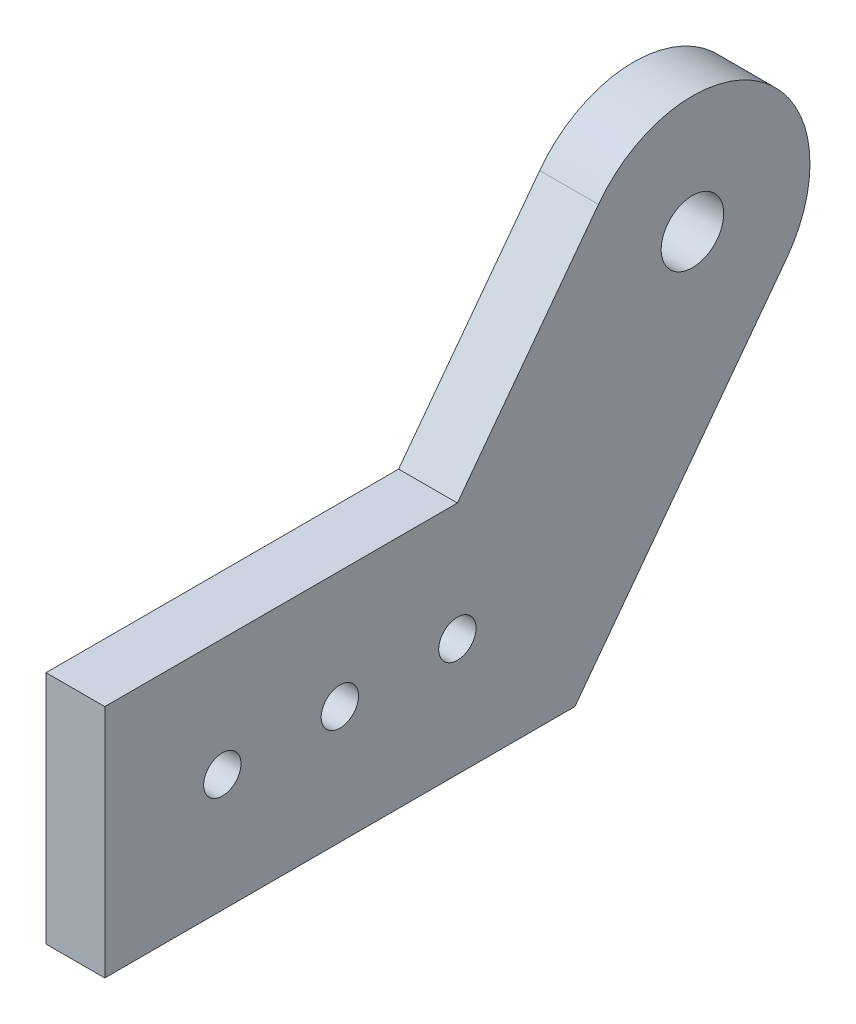
from build123d import *

# Parameters (mm, degrees)
BOSS_EXTRUDE1_DEPTH     = 6.35
F_10_32_TAPPED_HOLE1_D  = 4.0386
F_1_4_CLEARANCE_HOLE1_D = 6.7564


with BuildPart() as part:
    # Sketch1 → Boss-Extrude1 (new body)
    with BuildSketch(Plane(origin=(0, 0, 0), x_dir=(0, 0, -1), z_dir=(1, 0, 0))):
        with BuildLine():
            Line((50.8, 0), (73.66, 30.48))
            ThreePointArc((73.66, 30.48), (71.12, 48.26), (53.34, 45.72))
            Line((53.34, 45.72), (38.1, 25.4))
            Line((38.1, 25.4), (0, 25.4))
            Line((0, 25.4), (0, 0))
            Line((0, 0), (50.8, 0))
        make_face()
    extrude(amount=BOSS_EXTRUDE1_DEPTH)

    # #10-32 Tapped Hole1 (through all)
    with Locations(Plane(origin=(6.35, 0, 0), x_dir=(0, 0, -1), z_dir=(1, 0, 0))):
        with Locations((12.7, 12.7), (25.4, 12.7), (38.1, 12.7)):
            Hole(F_10_32_TAPPED_HOLE1_D / 2)

    # 1/4 Clearance Hole1 (through all)
    with Locations(Plane(origin=(6.35, 0, 0), x_dir=(0, 0, -1), z_dir=(1, 0, 0))):
        with Locations((63.5, 38.1)):
            Hole(F_1_4_CLEARANCE_HOLE1_D / 2)


solid = part.part
